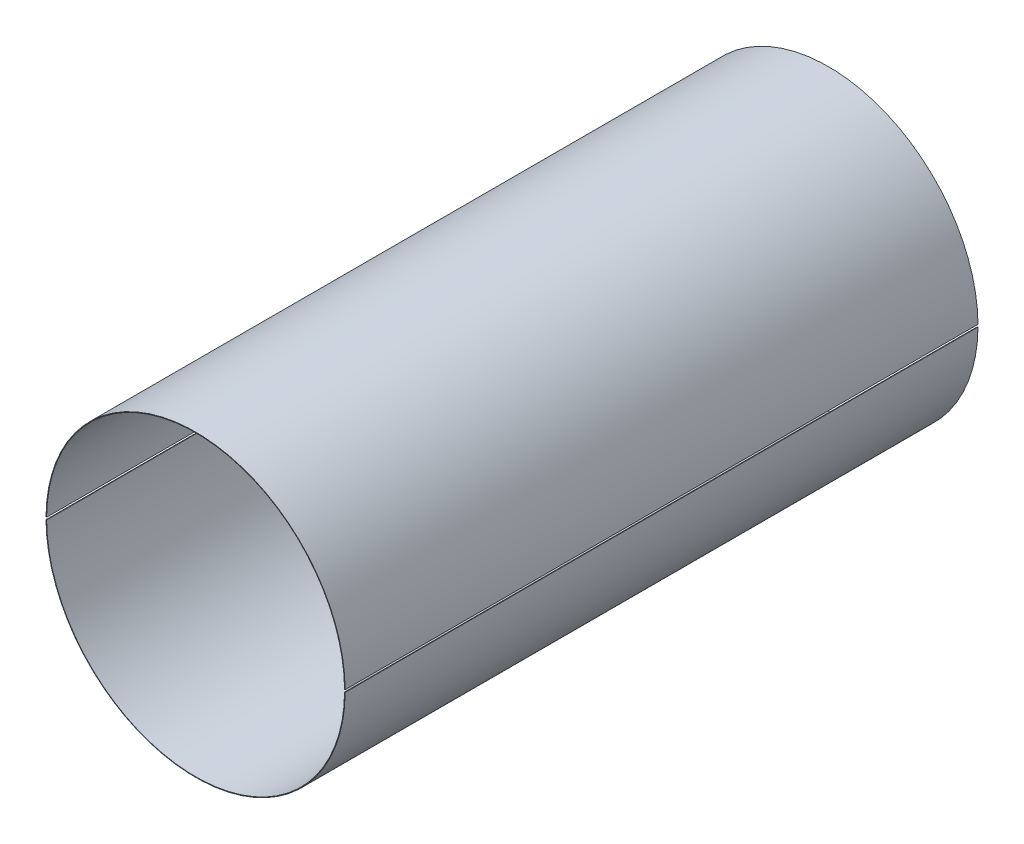
from build123d import *

# Parameters (mm, degrees)
SKETCH2_R               = 66.04
SKETCH2_R_2             = 65.786
BOSS_EXTRUDE1_DEPTH     = 279.4
CUT_EXTRUDE1_DEPTH      = 317.023366225
CUT_EXTRUDE1_DEPTH_BACK = 317.023366225
SKETCH5_W               = 279.4
SKETCH5_H               = 1.016


with BuildPart() as part:
    # Sketch2 → Boss-Extrude1 (new body)
    with BuildSketch(Plane.XY):
        Circle(SKETCH2_R)
        Circle(SKETCH2_R_2, mode=Mode.SUBTRACT)
    extrude(amount=BOSS_EXTRUDE1_DEPTH)

    # Sketch5 → Cut-Extrude1 (cut, two sides: drawn at the far end of the back side and taken through both)
    with BuildSketch(Plane.ZY.offset(66.04).offset(-CUT_EXTRUDE1_DEPTH_BACK)):
        with Locations((139.7, 0)):
            Rectangle(SKETCH5_W, SKETCH5_H)
    extrude(amount=CUT_EXTRUDE1_DEPTH + CUT_EXTRUDE1_DEPTH_BACK, mode=Mode.SUBTRACT)


with BuildPart() as cut_extrude1_piece_1:
    # of the separate pieces the step leaves, piece 1, a body of its own (cut_extrude1_pieces)
    add(part.part.solids().sort_by_distance((66.038046125, 0.508, 0))[0])


with BuildPart() as cut_extrude1_piece_2:
    # of the separate pieces the step leaves, piece 2, a body of its own (cut_extrude1_pieces)
    add(part.part.solids().sort_by_distance((-66.038046125, -0.508, 0))[0])


solid = Compound([cut_extrude1_piece_1.part, cut_extrude1_piece_2.part])
